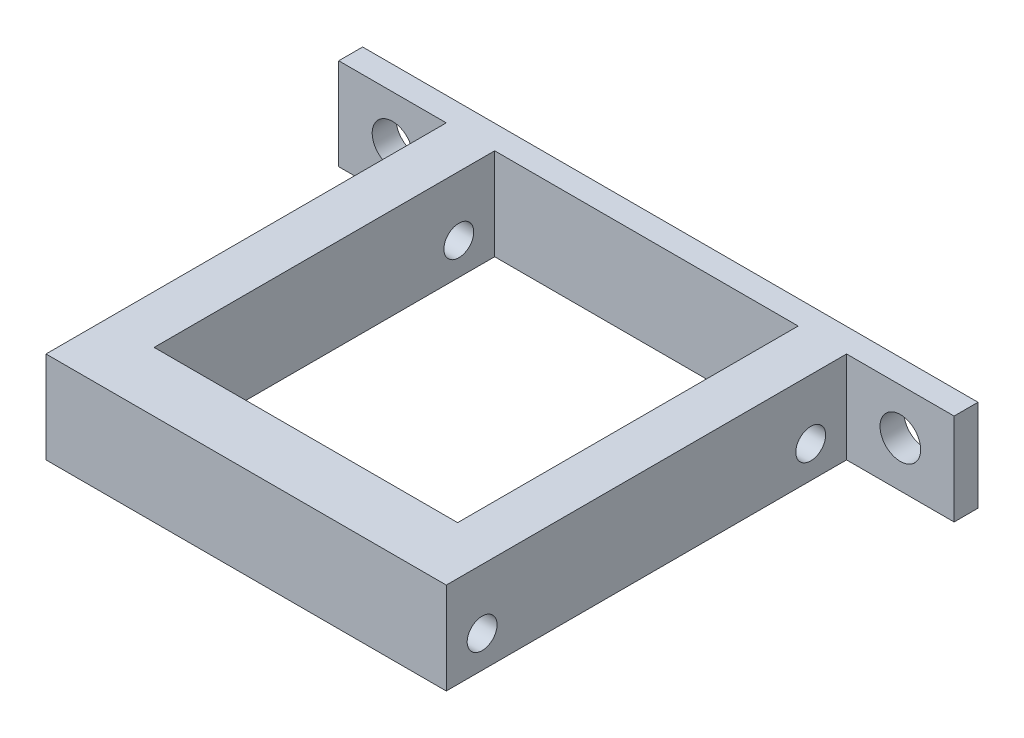
from build123d import *

# Parameters (mm, degrees)
SKETCH25_W                          = 25.4
SKETCH25_H                          = 28.5
BOSS_EXTRUDE5_DEPTH                 = 7.68
M3X0_5_TAPPED_HOLE2_D               = 2.5
M3X0_5_TAPPED_HOLE2_DEPTH           = 7.62
M3X0_5_TAPPED_HOLE2_TIP             = 0.751075774
M3X0_5_TAPPED_HOLE2_ON_FACE_2_D     = 2.5
M3X0_5_TAPPED_HOLE2_ON_FACE_2_DEPTH = 7.62
M3X0_5_TAPPED_HOLE2_ON_FACE_2_TIP   = 0.751075774
M3_CLEARANCE_HOLE3_D                = 3.4


with BuildPart() as part:
    # Sketch25 → Boss-Extrude5 (new body)
    with BuildSketch(Plane(origin=(0, 0, 0), x_dir=(1, 0, 0), z_dir=(0, 1, 0))):
        Polygon((25.75, 28.75), (-25.75, 28.75), (-25.75, 26.75), (-16.75, 26.75), (-16.75, -6.75), (16.75, -6.75), (16.75, 26.75), (25.75, 26.75), align=None)
        with Locations((0, 12.5)):
            Rectangle(SKETCH25_W, SKETCH25_H, mode=Mode.SUBTRACT)
    extrude(amount=-BOSS_EXTRUDE5_DEPTH)

    # M3x0.5 Tapped Hole2
    with Locations(Plane(origin=(16.75, -5, 3.75), x_dir=(0, 0, 1), z_dir=(1, 0, 0))):
        with Locations((0, 0), (-27.5, 0)):
            Hole(M3X0_5_TAPPED_HOLE2_D / 2, depth=M3X0_5_TAPPED_HOLE2_DEPTH)
            with Locations((0, 0, -(M3X0_5_TAPPED_HOLE2_DEPTH + M3X0_5_TAPPED_HOLE2_TIP / 2))):  # 118° drill point
                Cone(0, M3X0_5_TAPPED_HOLE2_D / 2, M3X0_5_TAPPED_HOLE2_TIP, mode=Mode.SUBTRACT)

    # M3x0.5 Tapped Hole2 on face 2
    with Locations(Plane(origin=(-16.75, -5, -23.75), x_dir=(0, 0, -1), z_dir=(-1, 0, 0))):
        with Locations((0, 0), (-27.5, 0)):
            Hole(M3X0_5_TAPPED_HOLE2_ON_FACE_2_D / 2, depth=M3X0_5_TAPPED_HOLE2_ON_FACE_2_DEPTH)
            with Locations((0, 0, -(M3X0_5_TAPPED_HOLE2_ON_FACE_2_DEPTH + M3X0_5_TAPPED_HOLE2_ON_FACE_2_TIP / 2))):  # 118° drill point
                Cone(0, M3X0_5_TAPPED_HOLE2_ON_FACE_2_D / 2, M3X0_5_TAPPED_HOLE2_ON_FACE_2_TIP, mode=Mode.SUBTRACT)

    # M3 Clearance Hole3 (through all)
    with Locations(Plane(origin=(21.25, -3.84, -26.75), x_dir=(1, 0, 0), z_dir=(0, 0, 1))):
        with Locations((0, 0), (-42.5, 0)):
            Hole(M3_CLEARANCE_HOLE3_D / 2)


solid = part.part
